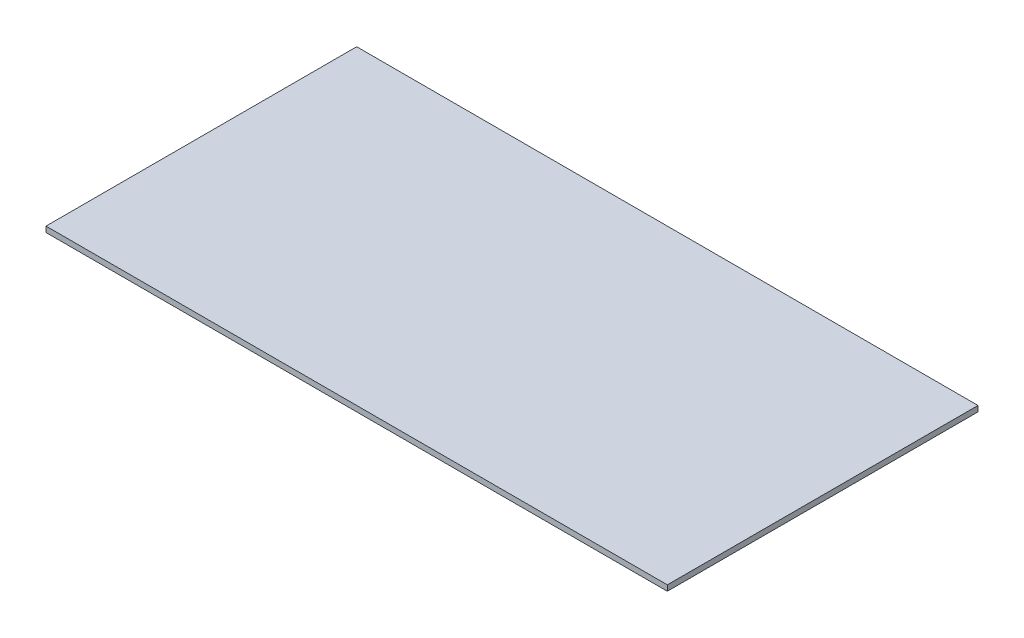
from build123d import *

# Parameters (mm, degrees)
SKETCH1_W           = 2000
SKETCH1_H           = 1000
BOSS_EXTRUDE1_DEPTH = 18


with BuildPart() as part:
    # Sketch1 → Boss-Extrude1 (new body)
    with BuildSketch(Plane(origin=(0, 0, 0), x_dir=(1, 0, 0), z_dir=(0, 1, 0))):
        with Locations((1000, 500)):
            Rectangle(SKETCH1_W, SKETCH1_H)
    extrude(amount=BOSS_EXTRUDE1_DEPTH)


solid = part.part
